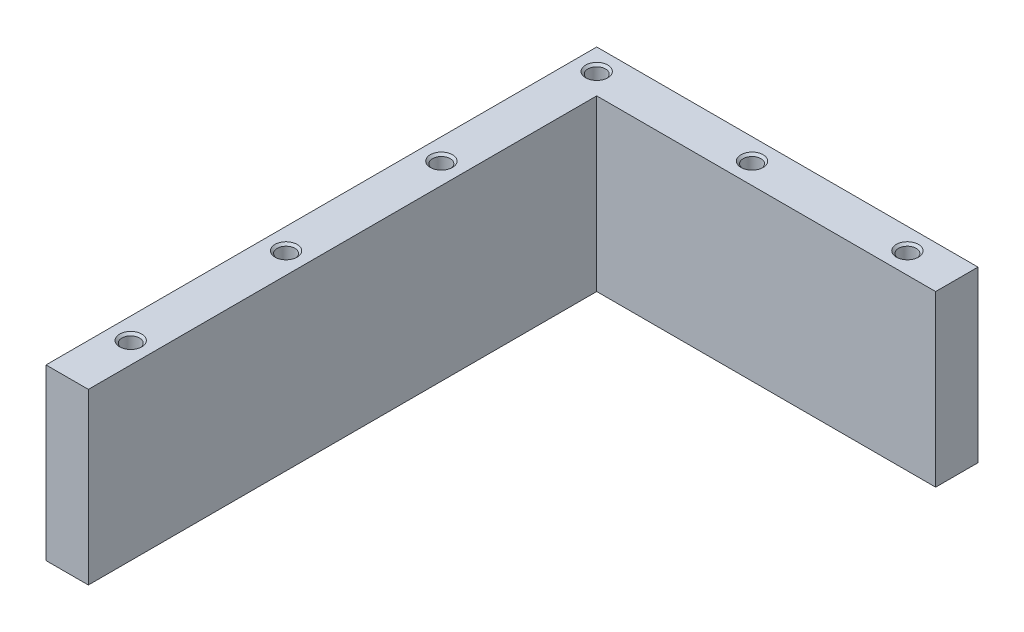
from build123d import *

# Parameters (mm, degrees)
BOSS_EXTRUDE1_DEPTH                           = 38.1
CBORE_FOR_4_SOCKET_HEAD_CAP_SCREW1_AT_2_COUNT = 2
CBORE_FOR_4_SOCKET_HEAD_CAP_SCREW1_AT_2_PITCH = 34.925
CBORE_FOR_4_SOCKET_HEAD_CAP_SCREW1_AT_3_COUNT = 2
CBORE_FOR_4_SOCKET_HEAD_CAP_SCREW1_AT_3_PITCH = 69.85
CBORE_FOR_4_SOCKET_HEAD_CAP_SCREW1_AT_4_COUNT = 2
CBORE_FOR_4_SOCKET_HEAD_CAP_SCREW1_AT_4_PITCH = 34.925
CBORE_FOR_4_SOCKET_HEAD_CAP_SCREW1_AT_5_COUNT = 2
CBORE_FOR_4_SOCKET_HEAD_CAP_SCREW1_AT_5_PITCH = 69.85
CBORE_FOR_4_SOCKET_HEAD_CAP_SCREW1_AT_6_COUNT = 2
CBORE_FOR_4_SOCKET_HEAD_CAP_SCREW1_AT_6_PITCH = 104.775
CHAMFER1_SIZE                                 = 0.508


with BuildPart() as part:
    # Sketch1 → Boss-Extrude1 (new body)
    with BuildSketch(Plane(origin=(0, 0, 0), x_dir=(1, 0, 0), z_dir=(0, 1, 0))):
        Polygon((0, 0), (85.725, 0), (85.725, -9.525), (9.525, -9.525), (9.525, -123.825), (0, -123.825), align=None)
    extrude(amount=BOSS_EXTRUDE1_DEPTH)

    # Sketch2 → CBORE for #4 Socket Head Cap Screw1 (revolve, cut)
    with BuildSketch(Plane(origin=(4.7625, 0, 4.7625), x_dir=(0, 0, -1), z_dir=(1, 0, 0))):
        Polygon((0, 0), (0, 13.680574487), (1.63195, 12.7), (1.63195, 4.7625), (1.984375, 4.7625), (1.984375, 0), align=None)
    cbore_for_4_socket_head_cap_screw1 = revolve(axis=Axis((4.7625, -6.35, 4.7625), (0, 1, 0)), mode=Mode.SUBTRACT)

    # CBORE for #4 Socket Head Cap Screw1 at 2: CBORE for #4 Socket Head Cap Screw1 ×2
    with Locations(*[(0, 0, i * CBORE_FOR_4_SOCKET_HEAD_CAP_SCREW1_AT_2_PITCH) for i in range(1, CBORE_FOR_4_SOCKET_HEAD_CAP_SCREW1_AT_2_COUNT)]):
        add(cbore_for_4_socket_head_cap_screw1, mode=Mode.SUBTRACT)

    # CBORE for #4 Socket Head Cap Screw1 at 3: CBORE for #4 Socket Head Cap Screw1 ×2
    with Locations(*[(0, 0, i * CBORE_FOR_4_SOCKET_HEAD_CAP_SCREW1_AT_3_PITCH) for i in range(1, CBORE_FOR_4_SOCKET_HEAD_CAP_SCREW1_AT_3_COUNT)]):
        add(cbore_for_4_socket_head_cap_screw1, mode=Mode.SUBTRACT)

    # CBORE for #4 Socket Head Cap Screw1 at 4: CBORE for #4 Socket Head Cap Screw1 ×2
    with Locations(*[(i * CBORE_FOR_4_SOCKET_HEAD_CAP_SCREW1_AT_4_PITCH, 0, 0) for i in range(1, CBORE_FOR_4_SOCKET_HEAD_CAP_SCREW1_AT_4_COUNT)]):
        add(cbore_for_4_socket_head_cap_screw1, mode=Mode.SUBTRACT)

    # CBORE for #4 Socket Head Cap Screw1 at 5: CBORE for #4 Socket Head Cap Screw1 ×2
    with Locations(*[(i * CBORE_FOR_4_SOCKET_HEAD_CAP_SCREW1_AT_5_PITCH, 0, 0) for i in range(1, CBORE_FOR_4_SOCKET_HEAD_CAP_SCREW1_AT_5_COUNT)]):
        add(cbore_for_4_socket_head_cap_screw1, mode=Mode.SUBTRACT)

    # CBORE for #4 Socket Head Cap Screw1 at 6: CBORE for #4 Socket Head Cap Screw1 ×2
    with Locations(*[(0, 0, i * CBORE_FOR_4_SOCKET_HEAD_CAP_SCREW1_AT_6_PITCH) for i in range(1, CBORE_FOR_4_SOCKET_HEAD_CAP_SCREW1_AT_6_COUNT)]):
        add(cbore_for_4_socket_head_cap_screw1, mode=Mode.SUBTRACT)

    # Mirror CBORE for #4 Socket Head Cap Screw: CBORE for #4 Socket Head Cap Screw1 across plane
    add(cbore_for_4_socket_head_cap_screw1.mirror(Plane.ZX.offset(19.05)), mode=Mode.SUBTRACT)

    # Mirror CBORE for _4 Socket Head Cap  2 → Mirror CBORE for _4 Socket Head Cap  3 (revolve, cut)
    with BuildSketch(Plane(origin=(4.7625, 38.1, 39.6875), x_dir=(0, 0, -1), z_dir=(1, 0, 0))):
        Polygon((0, 0), (0, -13.680574487), (1.63195, -12.7), (1.63195, -4.7625), (1.984375, -4.7625), (1.984375, 0), align=None)
    revolve(axis=Axis((4.7625, 44.45, 39.6875), (0, 1, 0)), mode=Mode.SUBTRACT)

    # Mirror CBORE for _4 Socket Head Cap  4 → Mirror CBORE for _4 Socket Head Cap  5 (revolve, cut)
    with BuildSketch(Plane(origin=(4.7625, 38.1, 74.6125), x_dir=(0, 0, -1), z_dir=(1, 0, 0))):
        Polygon((0, 0), (0, -13.680574487), (1.63195, -12.7), (1.63195, -4.7625), (1.984375, -4.7625), (1.984375, 0), align=None)
    revolve(axis=Axis((4.7625, 44.45, 74.6125), (0, 1, 0)), mode=Mode.SUBTRACT)

    # Mirror CBORE for _4 Socket Head Cap  6 → Mirror CBORE for _4 Socket Head Cap  7 (revolve, cut)
    with BuildSketch(Plane(origin=(39.6875, 38.1, 4.7625), x_dir=(0, 0, -1), z_dir=(1, 0, 0))):
        Polygon((0, 0), (0, -13.680574487), (1.63195, -12.7), (1.63195, -4.7625), (1.984375, -4.7625), (1.984375, 0), align=None)
    revolve(axis=Axis((39.6875, 44.45, 4.7625), (0, 1, 0)), mode=Mode.SUBTRACT)

    # Mirror CBORE for _4 Socket Head Cap  8 → Mirror CBORE for _4 Socket Head Cap  9 (revolve, cut)
    with BuildSketch(Plane(origin=(74.6125, 38.1, 4.7625), x_dir=(0, 0, -1), z_dir=(1, 0, 0))):
        Polygon((0, 0), (0, -13.680574487), (1.63195, -12.7), (1.63195, -4.7625), (1.984375, -4.7625), (1.984375, 0), align=None)
    revolve(axis=Axis((74.6125, 44.45, 4.7625), (0, 1, 0)), mode=Mode.SUBTRACT)

    # Mirror CBORE for _4 Socket Head Cap  10 → Mirror CBORE for _4 Socket Head Cap  11 (revolve, cut)
    with BuildSketch(Plane(origin=(4.7625, 38.1, 109.5375), x_dir=(0, 0, -1), z_dir=(1, 0, 0))):
        Polygon((0, 0), (0, -13.680574487), (1.63195, -12.7), (1.63195, -4.7625), (1.984375, -4.7625), (1.984375, 0), align=None)
    revolve(axis=Axis((4.7625, 44.45, 109.5375), (0, 1, 0)), mode=Mode.SUBTRACT)

    # Chamfer1
    # the kernel refuses this chamfer: 0.508 mm, written as the material it adds along each edge
    with BuildSketch(Plane(origin=(4.7625, 4.7625, 4.7625), x_dir=(0, 0, -1), z_dir=(1, 0, 0))) as chamfer1_piece_1_section:
        Polygon((1.984375, -CHAMFER1_SIZE), (1.984375 - CHAMFER1_SIZE, 0), (1.984375, 0), align=None)
    chamfer1_piece_1 = revolve(axis=Axis((4.7625, 4.7625, 4.7625), (0, 1, 0)), mode=Mode.PRIVATE)
    chamfer1_piece_1 = chamfer1_piece_1 - Plane(origin=(4.7625, 4.431570678, 4.7625), x_dir=(0, 0, -1), z_dir=(0, -1, 0)) * Cylinder(1.63195, 8, mode=Mode.PRIVATE)
    add(chamfer1_piece_1)
    with BuildSketch(Plane(origin=(4.7625, 4.7625, 74.6125), x_dir=(0, 0, -1), z_dir=(1, 0, 0))) as chamfer1_piece_2_section:
        Polygon((1.984375, -CHAMFER1_SIZE), (1.984375 - CHAMFER1_SIZE, 0), (1.984375, 0), align=None)
    chamfer1_piece_2 = revolve(axis=Axis((4.7625, 4.7625, 74.6125), (0, 1, 0)), mode=Mode.PRIVATE)
    chamfer1_piece_2 = chamfer1_piece_2 - Plane(origin=(4.7625, 4.431570678, 74.6125), x_dir=(0, 0, -1), z_dir=(0, -1, 0)) * Cylinder(1.63195, 8, mode=Mode.PRIVATE)
    add(chamfer1_piece_2)
    with BuildSketch(Plane(origin=(39.6875, 33.3375, 4.7625), x_dir=(0, 0, -1), z_dir=(1, 0, 0))) as chamfer1_piece_3_section:
        Polygon((1.984375, CHAMFER1_SIZE), (1.984375 - CHAMFER1_SIZE, 0), (1.984375, 0), align=None)
    chamfer1_piece_3 = revolve(axis=Axis((39.6875, 33.3375, 4.7625), (0, 1, 0)), mode=Mode.PRIVATE)
    chamfer1_piece_3 = chamfer1_piece_3 - Plane(origin=(39.6875, 33.668429322, 4.7625), x_dir=(0, 0, -1), z_dir=(0, 1, 0)) * Cylinder(1.63195, 8, mode=Mode.PRIVATE)
    add(chamfer1_piece_3)
    # the kernel refuses this chamfer: 0.508 mm, written as the material it takes off along each edge
    with BuildSketch(Plane(origin=(4.7625, 0, 4.7625), x_dir=(0, 0, -1), z_dir=(1, 0, 0))) as chamfer1_2_piece_1:
        Polygon((1.984375 + CHAMFER1_SIZE, 0), (1.984375, CHAMFER1_SIZE), (1.984375, 0), align=None)
    revolve(axis=Axis((4.7625, 0, 4.7625), (0, 1, 0)), mode=Mode.SUBTRACT)
    with BuildSketch(Plane(origin=(4.7625, 0, 74.6125), x_dir=(0, 0, -1), z_dir=(1, 0, 0))) as chamfer1_2_piece_2:
        Polygon((1.984375 + CHAMFER1_SIZE, 0), (1.984375, CHAMFER1_SIZE), (1.984375, 0), align=None)
    revolve(axis=Axis((4.7625, 0, 74.6125), (0, 1, 0)), mode=Mode.SUBTRACT)
    with BuildSketch(Plane(origin=(74.6125, 0, 4.7625), x_dir=(0, 0, -1), z_dir=(1, 0, 0))) as chamfer1_2_piece_3:
        Polygon((1.984375 + CHAMFER1_SIZE, 0), (1.984375, CHAMFER1_SIZE), (1.984375, 0), align=None)
    revolve(axis=Axis((74.6125, 0, 4.7625), (0, 1, 0)), mode=Mode.SUBTRACT)
    with BuildSketch(Plane(origin=(39.6875, 0, 4.7625), x_dir=(0, 0, -1), z_dir=(1, 0, 0))) as chamfer1_2_piece_4:
        Polygon((1.984375 + CHAMFER1_SIZE, 0), (1.984375, CHAMFER1_SIZE), (1.984375, 0), align=None)
    revolve(axis=Axis((39.6875, 0, 4.7625), (0, 1, 0)), mode=Mode.SUBTRACT)
    with BuildSketch(Plane(origin=(4.7625, 0, 39.6875), x_dir=(0, 0, -1), z_dir=(1, 0, 0))) as chamfer1_2_piece_5:
        Polygon((1.984375 + CHAMFER1_SIZE, 0), (1.984375, CHAMFER1_SIZE), (1.984375, 0), align=None)
    revolve(axis=Axis((4.7625, 0, 39.6875), (0, 1, 0)), mode=Mode.SUBTRACT)
    with BuildSketch(Plane(origin=(4.7625, 0, 109.5375), x_dir=(0, 0, -1), z_dir=(1, 0, 0))) as chamfer1_2_piece_6:
        Polygon((1.984375 + CHAMFER1_SIZE, 0), (1.984375, CHAMFER1_SIZE), (1.984375, 0), align=None)
    revolve(axis=Axis((4.7625, 0, 109.5375), (0, 1, 0)), mode=Mode.SUBTRACT)
    with BuildSketch(Plane(origin=(39.6875, 38.1, 4.7625), x_dir=(0, 0, -1), z_dir=(1, 0, 0))) as chamfer1_2_piece_7:
        Polygon((1.984375 + CHAMFER1_SIZE, 0), (1.984375, -CHAMFER1_SIZE), (1.984375, 0), align=None)
    revolve(axis=Axis((39.6875, 38.1, 4.7625), (0, 1, 0)), mode=Mode.SUBTRACT)
    with BuildSketch(Plane(origin=(74.6125, 38.1, 4.7625), x_dir=(0, 0, -1), z_dir=(1, 0, 0))) as chamfer1_2_piece_8:
        Polygon((1.984375 + CHAMFER1_SIZE, 0), (1.984375, -CHAMFER1_SIZE), (1.984375, 0), align=None)
    revolve(axis=Axis((74.6125, 38.1, 4.7625), (0, 1, 0)), mode=Mode.SUBTRACT)
    with BuildSketch(Plane(origin=(4.7625, 38.1, 4.7625), x_dir=(0, 0, -1), z_dir=(1, 0, 0))) as chamfer1_2_piece_9:
        Polygon((1.984375 + CHAMFER1_SIZE, 0), (1.984375, -CHAMFER1_SIZE), (1.984375, 0), align=None)
    revolve(axis=Axis((4.7625, 38.1, 4.7625), (0, 1, 0)), mode=Mode.SUBTRACT)
    with BuildSketch(Plane(origin=(4.7625, 38.1, 39.6875), x_dir=(0, 0, -1), z_dir=(1, 0, 0))) as chamfer1_2_piece_10:
        Polygon((1.984375 + CHAMFER1_SIZE, 0), (1.984375, -CHAMFER1_SIZE), (1.984375, 0), align=None)
    revolve(axis=Axis((4.7625, 38.1, 39.6875), (0, 1, 0)), mode=Mode.SUBTRACT)
    with BuildSketch(Plane(origin=(4.7625, 38.1, 74.6125), x_dir=(0, 0, -1), z_dir=(1, 0, 0))) as chamfer1_2_piece_11:
        Polygon((1.984375 + CHAMFER1_SIZE, 0), (1.984375, -CHAMFER1_SIZE), (1.984375, 0), align=None)
    revolve(axis=Axis((4.7625, 38.1, 74.6125), (0, 1, 0)), mode=Mode.SUBTRACT)
    with BuildSketch(Plane(origin=(4.7625, 38.1, 109.5375), x_dir=(0, 0, -1), z_dir=(1, 0, 0))) as chamfer1_2_piece_12:
        Polygon((1.984375 + CHAMFER1_SIZE, 0), (1.984375, -CHAMFER1_SIZE), (1.984375, 0), align=None)
    revolve(axis=Axis((4.7625, 38.1, 109.5375), (0, 1, 0)), mode=Mode.SUBTRACT)


solid = part.part
